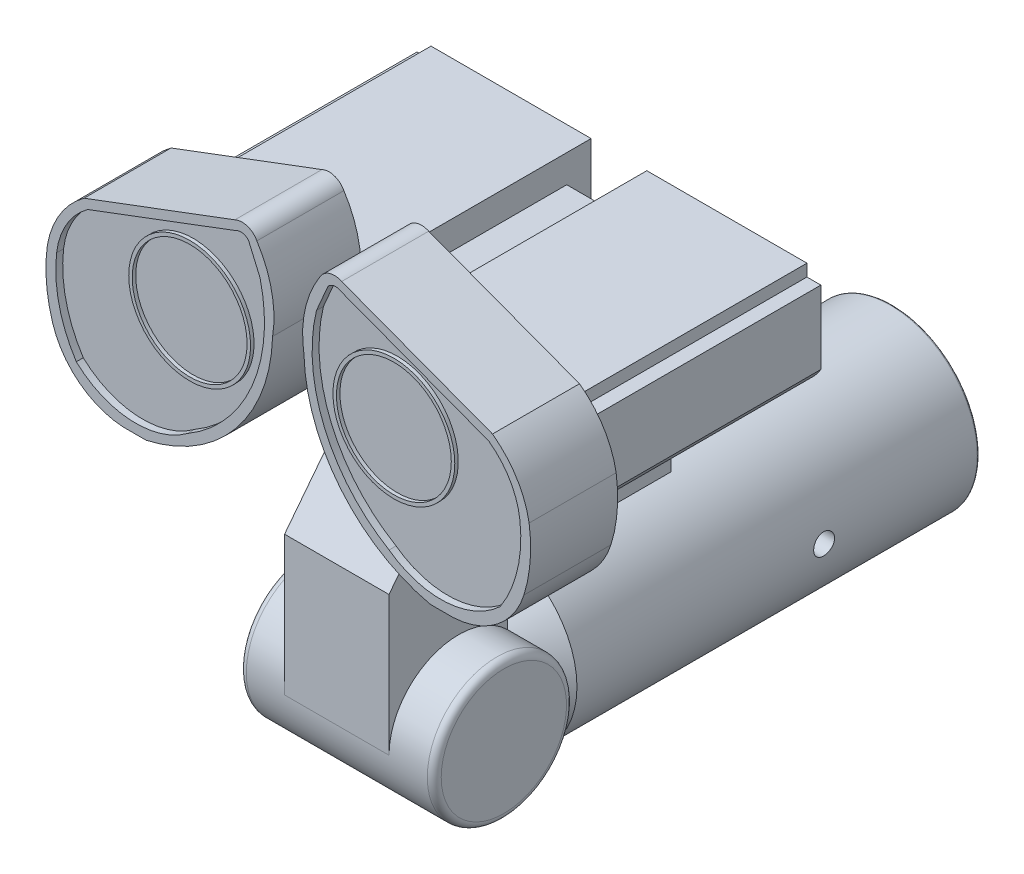
from build123d import *

# Parameters (mm, degrees)
HINGE_CONNECTED_TO_BOTTOM_TUBE_DEPTH      = 1.4
HINGE_CONNECTED_TO_BOTTOM_TUBE_DEPTH_BACK = 1.4
SKETCH3_R                                 = 1
FILLET_ON_HINGE_R                         = 0.1
BASE_CONNECTED_TO_EYES_DEPTH              = 0.75
BASE_CONNECTED_TO_EYES_DEPTH_BACK         = 0.75
EYE_BACKING_DEPTH                         = 3.5
SKETCH7_W                                 = 0.8
SKETCH7_H                                 = 3.5
EYE_BACKING_DETAILS_DEPTH                 = 1.07
SKETCH8_W                                 = 0.8
SKETCH8_H                                 = 1.9
MIDDLE_OF_EYE_BACKING_DEPTH               = 0.67
SKETCH12_R                                = 0.875
OUTER_EYE_DEPTH                           = 1.25
INNER_EYE_CUT_DEPTH                       = 0.1
SKETCH12_5_R                              = 0.875
SKETCH12_5_R_2                            = 0.825
OUTER_LENS_DEPTH                          = 1.2
SKETCH12_7_R                              = 0.825
INNER_LENS_CUT_DEPTH                      = 1.15
CUT_EXTRUDE3_REACH                        = 13.236
SKETCH15_R                                = 0.15
CUT_EXTRUDE3_DIRECTION_2_REACH            = 13.236
SKETCH12_6_R                              = 0.825
BOSS_EXTRUDE16_DEPTH                      = 1.15


with BuildPart() as part:
    # Sketch2 → Bottom tube (revolve)
    with BuildSketch(Plane(origin=(0, 0, 0), x_dir=(0, 0, -1), z_dir=(1, 0, 0))):
        with BuildLine():
            Line((-6.25, 0), (0.163609492, 0))
            add(Edge.make_bspline(
                [(0.163609492, 0), (0.163609492, 1.25), (0, 1.25)],
                knots=[4.71238898, 4.71238898, 4.71238898, 6.283185307, 6.283185307, 6.283185307], degree=2, weights=[1, 0.707106781, 1]))
            Line((0, 1.25), (-5.75, 1.25))
            Line((-5.75, 1.25), (-6.25, 0.75))
            Line((-6.25, 0.75), (-6.25, 0))
        make_face()
    revolve(axis=Axis((0, 0, 6.25), (0, 0, -1)))

    # Sketch3 → Hinge connected to bottom tube (add, two sides: drawn at the far end of the back side and taken through both)
    with BuildSketch(Plane(origin=(0, 0, 0), x_dir=(0, 0, -1), z_dir=(1, 0, 0)).offset(-HINGE_CONNECTED_TO_BOTTOM_TUBE_DEPTH_BACK)):
        with Locations((-6.95, 0)):
            Circle(SKETCH3_R)
    extrude(amount=HINGE_CONNECTED_TO_BOTTOM_TUBE_DEPTH + HINGE_CONNECTED_TO_BOTTOM_TUBE_DEPTH_BACK)

    # fillet on hinge
    fillet_on_hinge_edges = [part.edges().sort_by_distance(p)[0] for p in [
        (1.4, 0, 7.95),
        (-1.4, 0, 7.95),
    ]]
    fillet(fillet_on_hinge_edges, radius=FILLET_ON_HINGE_R)

    # Sketch4 → base connected to eyes (add, two sides: drawn at the far end of the back side and taken through both)
    with BuildSketch(Plane(origin=(0, 0, 0), x_dir=(0, 0, -1), z_dir=(1, 0, 0)).offset(-BASE_CONNECTED_TO_EYES_DEPTH_BACK)):
        with BuildLine():
            Line((-7.95, 0), (-7.95, 2))
            Line((-7.95, 2), (-6.39677242, 4))
            Line((-6.39677242, 4), (-3.89677242, 4))
            Line((-3.89677242, 4), (-3.89677242, 1.5))
            Line((-3.89677242, 1.5), (-6.25, 1.5))
            Line((-6.25, 1.5), (-6.25, 0.714142843))
            ThreePointArc((-6.25, 0.714142843), (-7.337298335, 0.921954446), (-7.95, 0))
        make_face()
    extrude(amount=BASE_CONNECTED_TO_EYES_DEPTH + BASE_CONNECTED_TO_EYES_DEPTH_BACK)

    # Sketch5 → Eye backing (add)
    with BuildSketch(Plane(origin=(0, 0, 3.89677242), x_dir=(-1, 0, 0), z_dir=(0, 0, -1))):
        with BuildLine():
            Line((0.75, 3.5), (2.25, 3.5))
            ThreePointArc((2.25, 3.5), (2.62408667, 3.581702047), (2.9, 3.847197614))
            Line((2.9, 3.847197614), (2.9, 4.897197614))
            Line((2.9, 4.897197614), (2.7, 4.897197614))
            Line((2.7, 4.897197614), (2.7, 5.07))
            Line((2.7, 5.07), (-2.7, 5.07))
            Line((-2.7, 5.07), (-2.7, 4.897197614))
            Line((-2.7, 4.897197614), (-2.9, 4.897197614))
            Line((-2.9, 4.897197614), (-2.9, 3.847197614))
            ThreePointArc((-2.9, 3.847197614), (-2.62408667, 3.581702047), (-2.25, 3.5))
            Line((-2.25, 3.5), (-0.75, 3.5))
            Line((-0.75, 3.5), (-0.75, 4))
            Line((-0.75, 4), (0.75, 4))
            Line((0.75, 4), (0.75, 3.5))
        make_face()
    extrude(amount=-EYE_BACKING_DEPTH)

    # Sketch7 → Eye backing details (cut)
    with BuildSketch(Plane(origin=(0, 5.07, 0), x_dir=(1, 0, 0), z_dir=(0, 1, 0))):
        with Locations((0, -5.64677242)):
            Rectangle(SKETCH7_W, SKETCH7_H)
    extrude(amount=-EYE_BACKING_DETAILS_DEPTH, mode=Mode.SUBTRACT)

    # Sketch8 → Middle of eye backing (add)
    with BuildSketch(Plane(origin=(0, 4, 0), x_dir=(1, 0, 0), z_dir=(0, 1, 0))):
        with Locations((0, -5.19677242)):
            Rectangle(SKETCH8_W, SKETCH8_H)
    extrude(amount=MIDDLE_OF_EYE_BACKING_DEPTH)

    # Sketch12 → Outer eye (add)
    # profile 1 of 2: a face of its own
    with BuildSketch(Plane.XY.offset(7.39677242)):
        with BuildLine():
            ThreePointArc((-0.450961505, 6.145644801), (-0.587867618, 6.261837628), (-0.767083386, 6.250623109))
            Line((-0.767083386, 6.250623109), (-2.933329516, 5.436310045))
            ThreePointArc((-2.933329516, 5.436310045), (-3.278345677, 5.065387345), (-3.459739663, 4.592401064))
            ThreePointArc((-3.459739663, 4.592401064), (-3.474536987, 4.120986543), (-3.384350783, 3.658042637))
            ThreePointArc((-3.384350783, 3.658042637), (-3.001009551, 3.106292928), (-2.371698574, 2.871035758))
            Line((-2.371698574, 2.871035758), (-2.041485898, 2.871035758))
            ThreePointArc((-2.041485898, 2.871035758), (-0.756304939, 3.659066468), (-0.225316176, 5.07))
            ThreePointArc((-0.225316176, 5.07), (-0.238383659, 5.628748724), (-0.450961505, 6.145644801))
        make_face()
        with Locations((-1.466642551, 4.746410471)):
            Circle(SKETCH12_R, mode=Mode.SUBTRACT)
    # profile 2 of 2: a face of its own
    with BuildSketch(Plane.XY.offset(7.39677242)):
        with BuildLine():
            Line((2.041485898, 2.871035758), (2.371698574, 2.871035758))
            ThreePointArc((2.371698574, 2.871035758), (3.001009551, 3.106292928), (3.384350783, 3.658042637))
            ThreePointArc((3.384350783, 3.658042637), (3.474536987, 4.120986543), (3.459739663, 4.592401064))
            ThreePointArc((3.459739663, 4.592401064), (3.278345677, 5.065387345), (2.933329516, 5.436310045))
            Line((2.933329516, 5.436310045), (0.767083386, 6.250623109))
            ThreePointArc((0.767083386, 6.250623109), (0.587867618, 6.261837628), (0.450961505, 6.145644801))
            ThreePointArc((0.450961505, 6.145644801), (0.238383659, 5.628748724), (0.225316176, 5.07))
            ThreePointArc((0.225316176, 5.07), (0.756304939, 3.659066468), (2.041485898, 2.871035758))
        make_face()
        with Locations((1.466642551, 4.746410471)):
            Circle(SKETCH12_R, mode=Mode.SUBTRACT)
    extrude(amount=OUTER_EYE_DEPTH)

    # Sketch13 → Inner eye cut (cut)
    with BuildSketch(Plane.XY.offset(8.64677242)):
        with BuildLine():
            Line((-0.757964351, 6.121312443), (-2.880162803, 5.322245904))
            ThreePointArc((-2.880162803, 5.322245904), (-3.184019481, 4.988025414), (-3.327634423, 4.55976502))
            ThreePointArc((-3.327634423, 4.55976502), (-3.29208127, 3.928007422), (-3.044809473, 3.345565711))
            ThreePointArc((-3.044809473, 3.345565711), (-2.263619647, 3.009419304), (-1.448470515, 3.251873102))
            ThreePointArc((-1.448470515, 3.251873102), (-0.52016025, 4.307569927), (-0.404930121, 5.708633007))
            Line((-0.404930121, 5.708633007), (-0.570058708, 6.091643131))
            ThreePointArc((-0.570058708, 6.091643131), (-0.658423401, 6.141869268), (-0.757964351, 6.121312443))
        make_face()
        with BuildLine():
            Line((0.570058708, 6.091643131), (0.404930121, 5.708633007))
            ThreePointArc((0.404930121, 5.708633007), (0.52016025, 4.307569927), (1.448470515, 3.251873102))
            ThreePointArc((1.448470515, 3.251873102), (2.263619647, 3.009419304), (3.044809473, 3.345565711))
            ThreePointArc((3.044809473, 3.345565711), (3.29208127, 3.928007422), (3.327634423, 4.55976502))
            ThreePointArc((3.327634423, 4.55976502), (3.184019481, 4.988025414), (2.880162803, 5.322245904))
            Line((2.880162803, 5.322245904), (0.757964351, 6.121312443))
            ThreePointArc((0.757964351, 6.121312443), (0.658423401, 6.141869268), (0.570058708, 6.091643131))
        make_face()
    extrude(amount=-INNER_EYE_CUT_DEPTH, mode=Mode.SUBTRACT)

    # Sketch12<5> → Outer lens (add)
    # profile 1 of 2: a face of its own
    with BuildSketch(Plane.XY.offset(7.39677242)):
        with Locations((-1.466642551, 4.746410471)):
            Circle(SKETCH12_5_R)
        with Locations((-1.466642551, 4.746410471)):
            Circle(SKETCH12_5_R_2, mode=Mode.SUBTRACT)
    # profile 2 of 2: a face of its own
    with BuildSketch(Plane.XY.offset(7.39677242)):
        with Locations((1.466642551, 4.746410471)):
            Circle(SKETCH12_5_R)
        with Locations((1.466642551, 4.746410471)):
            Circle(SKETCH12_5_R_2, mode=Mode.SUBTRACT)
    extrude(amount=OUTER_LENS_DEPTH)

    # Sketch12<7> → Inner lens cut (add)
    with BuildSketch(Plane.XY.offset(7.39677242)):
        with Locations((-1.466642551, 4.746410471)):
            Circle(SKETCH12_7_R)
        with Locations((1.466642551, 4.746410471)):
            Circle(SKETCH12_7_R)
    extrude(amount=INNER_LENS_CUT_DEPTH)

    # Sketch15 → Cut-Extrude3 (cut, up to next)
    with BuildSketch(Plane(origin=(0, 0, 0), x_dir=(0, 0, -1), z_dir=(1, 0, 0)), mode=Mode.PRIVATE) as cut_extrude3_sk1:
        with Locations((-2.2, 0)):
            Circle(SKETCH15_R)
    cut_extrude3_tool1 = extrude(cut_extrude3_sk1.sketch, amount=-CUT_EXTRUDE3_REACH, mode=Mode.PRIVATE) & part.part
    add(cut_extrude3_tool1.solids().sort_by_distance((0, 0, 2.2))[0], mode=Mode.SUBTRACT)

    # Sketch15 → Cut-Extrude3 direction 2 (cut, up to next)
    with BuildSketch(Plane(origin=(0, 0, 0), x_dir=(0, 0, -1), z_dir=(1, 0, 0)), mode=Mode.PRIVATE) as cut_extrude3_direction_2_sk1:
        with Locations((-2.2, 0)):
            Circle(SKETCH15_R)
    cut_extrude3_direction_2_tool1 = extrude(cut_extrude3_direction_2_sk1.sketch, amount=CUT_EXTRUDE3_DIRECTION_2_REACH, mode=Mode.PRIVATE) & part.part
    add(cut_extrude3_direction_2_tool1.solids().sort_by_distance((0, 0, 2.2))[0], mode=Mode.SUBTRACT)

    # Sketch12<6> → Boss-Extrude16 (add)
    with BuildSketch(Plane.XY.offset(7.39677242)):
        with Locations((-1.466642551, 4.746410471)):
            Circle(SKETCH12_6_R)
        with Locations((1.466642551, 4.746410471)):
            Circle(SKETCH12_6_R)
    extrude(amount=BOSS_EXTRUDE16_DEPTH)


solid = part.part
